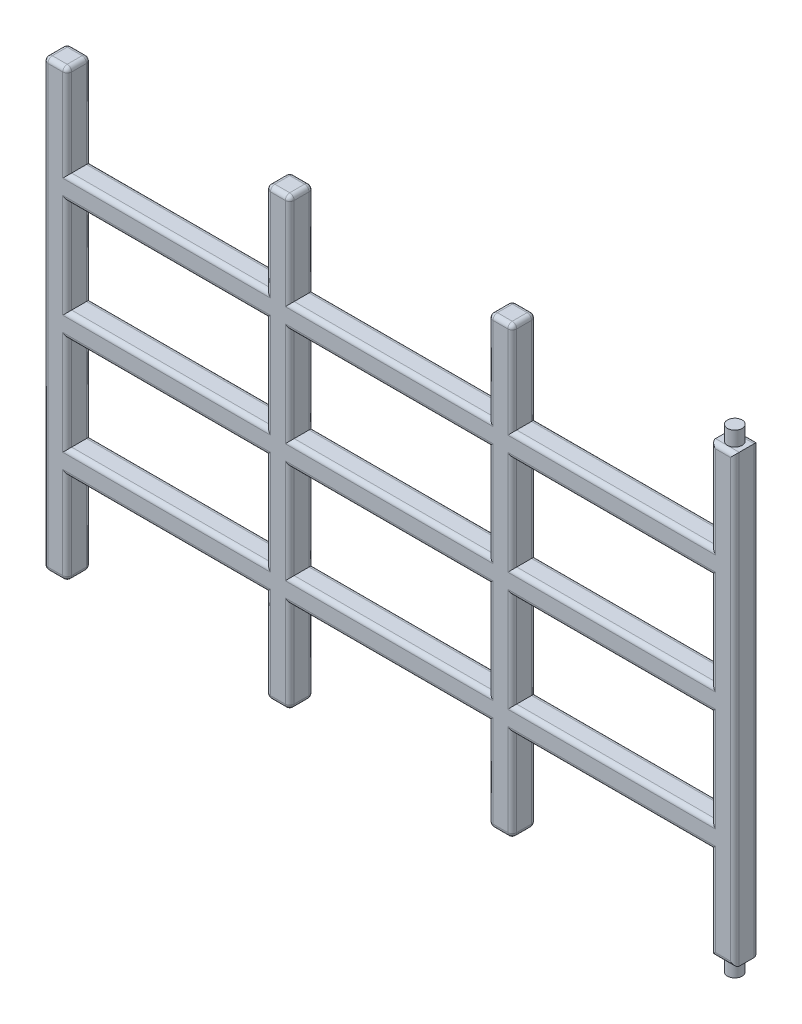
from build123d import *

# Parameters (mm, degrees)
SKETCH_1_W      = 8
SKETCH_1_H      = 31
SKETCH_1_W_2    = 67
SKETCH_1_H_2    = 8
SKETCH_1_H_3    = 32
EXTRUDE_1_DEPTH = 8
FILLET_3_R      = 1.5
SKETCH_2_R      = 2.475
EXTRUDE_5_DEPTH = 4.95
EXTRUDE_START   = 4.95
SKETCH_3_R      = 2.475
EXTRUDE_6_DEPTH = 4.95
FILLET_4_R      = 1.5


with BuildPart() as part:
    # 草图1 → 凸台-拉伸1 (new body)
    with BuildSketch(Plane.XY):
        with Locations((4, 134.5)):
            Rectangle(SKETCH_1_W, SKETCH_1_H)
        with Locations((41.5, 115)):
            Rectangle(SKETCH_1_W_2, SKETCH_1_H_2)
        with Locations((4, 115)):
            Rectangle(SKETCH_1_W, SKETCH_1_H_2)
        with Locations((4, 95)):
            Rectangle(SKETCH_1_W, SKETCH_1_H_3)
        with Locations((41.5, 75)):
            Rectangle(SKETCH_1_W_2, SKETCH_1_H_2)
        with Locations((4, 55)):
            Rectangle(SKETCH_1_W, SKETCH_1_H_3)
        with Locations((4, 75)):
            Rectangle(SKETCH_1_W, SKETCH_1_H_2)
        with Locations((4, 35)):
            Rectangle(SKETCH_1_W, SKETCH_1_H_2)
        with Locations((4, 15.5)):
            Rectangle(SKETCH_1_W, SKETCH_1_H)
        with Locations((41.5, 35)):
            Rectangle(SKETCH_1_W_2, SKETCH_1_H_2)
        with Locations((79, 35)):
            Rectangle(SKETCH_1_W, SKETCH_1_H_2)
        with Locations((79, 15.5)):
            Rectangle(SKETCH_1_W, SKETCH_1_H)
        with Locations((79, 55)):
            Rectangle(SKETCH_1_W, SKETCH_1_H_3)
        with Locations((79, 75)):
            Rectangle(SKETCH_1_W, SKETCH_1_H_2)
        with Locations((79, 95)):
            Rectangle(SKETCH_1_W, SKETCH_1_H_3)
        with Locations((79, 115)):
            Rectangle(SKETCH_1_W, SKETCH_1_H_2)
        with Locations((79, 134.5)):
            Rectangle(SKETCH_1_W, SKETCH_1_H)
        with Locations((116.5, 115)):
            Rectangle(SKETCH_1_W_2, SKETCH_1_H_2)
        with Locations((116.5, 75)):
            Rectangle(SKETCH_1_W_2, SKETCH_1_H_2)
        with Locations((116.5, 35)):
            Rectangle(SKETCH_1_W_2, SKETCH_1_H_2)
        with Locations((154, 15.5)):
            Rectangle(SKETCH_1_W, SKETCH_1_H)
        with Locations((154, 35)):
            Rectangle(SKETCH_1_W, SKETCH_1_H_2)
        with Locations((154, 55)):
            Rectangle(SKETCH_1_W, SKETCH_1_H_3)
        with Locations((154, 75)):
            Rectangle(SKETCH_1_W, SKETCH_1_H_2)
        with Locations((154, 95)):
            Rectangle(SKETCH_1_W, SKETCH_1_H_3)
        with Locations((154, 115)):
            Rectangle(SKETCH_1_W, SKETCH_1_H_2)
        with Locations((154, 134.5)):
            Rectangle(SKETCH_1_W, SKETCH_1_H)
        with Locations((191.5, 115)):
            Rectangle(SKETCH_1_W_2, SKETCH_1_H_2)
        with Locations((191.5, 75)):
            Rectangle(SKETCH_1_W_2, SKETCH_1_H_2)
        with Locations((191.5, 35)):
            Rectangle(SKETCH_1_W_2, SKETCH_1_H_2)
        with Locations((229, 15.5)):
            Rectangle(SKETCH_1_W, SKETCH_1_H)
        with Locations((229, 35)):
            Rectangle(SKETCH_1_W, SKETCH_1_H_2)
        with Locations((229, 55)):
            Rectangle(SKETCH_1_W, SKETCH_1_H_3)
        with Locations((229, 75)):
            Rectangle(SKETCH_1_W, SKETCH_1_H_2)
        with Locations((229, 95)):
            Rectangle(SKETCH_1_W, SKETCH_1_H_3)
        with Locations((229, 115)):
            Rectangle(SKETCH_1_W, SKETCH_1_H_2)
        with Locations((229, 134.5)):
            Rectangle(SKETCH_1_W, SKETCH_1_H)
    extrude(amount=EXTRUDE_1_DEPTH)

    # 圆角3
    fillet_3_edges = [part.edges().sort_by_distance(p)[0] for p in [
        (4, 150, 8),
        (0, 75, 8),
        (191.5, 31, 8),
        (4, 0, 8),
        (8, 15.5, 8),
        (41.5, 31, 8),
        (75, 15.5, 8),
        (79, 0, 8),
        (83, 15.5, 8),
        (116.5, 31, 8),
        (150, 15.5, 8),
        (154, 0, 8),
        (225, 15.5, 8),
        (158, 15.5, 8),
        (225, 55, 8),
        (191.5, 39, 8),
        (158, 55, 8),
        (191.5, 71, 8),
        (150, 55, 8),
        (116.5, 39, 8),
        (83, 55, 8),
        (116.5, 71, 8),
        (225, 95, 8),
        (229, 0, 8),
        (191.5, 79, 8),
        (158, 95, 8),
        (191.5, 111, 8),
        (75, 55, 8),
        (41.5, 39, 8),
        (8, 55, 8),
        (41.5, 71, 8),
        (150, 95, 8),
        (116.5, 79, 8),
        (83, 95, 8),
        (233, 75, 8),
        (116.5, 111, 8),
        (75, 95, 8),
        (41.5, 79, 8),
        (8, 95, 8),
        (41.5, 111, 8),
        (229, 150, 8),
        (225, 134.5, 8),
        (191.5, 119, 8),
        (158, 134.5, 8),
        (41.5, 111, 0),
        (8, 95, 0),
        (41.5, 79, 0),
        (75, 95, 0),
        (154, 150, 8),
        (116.5, 111, 0),
        (83, 95, 0),
        (116.5, 79, 0),
        (150, 95, 0),
        (41.5, 71, 0),
        (8, 55, 0),
        (41.5, 39, 0),
        (75, 55, 0),
        (191.5, 111, 0),
        (158, 95, 0),
        (150, 134.5, 8),
        (191.5, 79, 0),
        (225, 95, 0),
        (116.5, 71, 0),
        (83, 55, 0),
        (116.5, 39, 0),
        (150, 55, 0),
        (191.5, 71, 0),
        (158, 55, 0),
        (191.5, 39, 0),
        (225, 55, 0),
        (116.5, 119, 8),
        (158, 15.5, 0),
        (154, 0, 0),
        (150, 15.5, 0),
        (116.5, 31, 0),
        (83, 15.5, 0),
        (79, 0, 0),
        (75, 15.5, 0),
        (41.5, 31, 0),
        (8, 15.5, 0),
        (4, 0, 0),
        (83, 134.5, 8),
        (0, 75, 0),
        (4, 150, 0),
        (8, 134.5, 0),
        (41.5, 119, 0),
        (75, 134.5, 0),
        (79, 150, 0),
        (83, 134.5, 0),
        (116.5, 119, 0),
        (79, 150, 8),
        (150, 134.5, 0),
        (154, 150, 0),
        (158, 134.5, 0),
        (191.5, 119, 0),
        (225, 134.5, 0),
        (229, 150, 0),
        (233, 75, 0),
        (229, 0, 0),
        (75, 134.5, 8),
        (225, 15.5, 0),
        (191.5, 31, 0),
        (41.5, 119, 8),
        (8, 134.5, 8),
    ]]
    fillet(fillet_3_edges, radius=FILLET_3_R)

    # 草图2 → 凸台-拉伸5 (add)
    with BuildSketch(Plane(origin=(0, 150, 0), x_dir=(1, 0, 0), z_dir=(0, 1, 0))):
        with Locations((229, -4)):
            Circle(SKETCH_2_R)
    extrude(amount=EXTRUDE_5_DEPTH)

    # 草图3 → 凸台-拉伸6 (add)
    with BuildSketch(Plane.XZ.offset(EXTRUDE_START)):
        with Locations((229, 4)):
            Circle(SKETCH_3_R)
    extrude(amount=-EXTRUDE_6_DEPTH)

    # 圆角4
    # the kernel refuses this fillet: 1.5 mm, written as the material it takes off along each edge
    with BuildSketch(Plane(origin=(76.5, 148.5, 6.5), x_dir=(-1, 0, 0), z_dir=(0, 1, 0))) as fillet_4_piece_1_section:
        Polygon((0, 0), (FILLET_4_R, 0), (FILLET_4_R, FILLET_4_R), (0, FILLET_4_R), align=None)
    fillet_4_piece_1 = extrude(amount=FILLET_4_R, mode=Mode.PRIVATE)
    fillet_4_piece_1 = fillet_4_piece_1 - Plane(origin=(76.5, 148.5, 6.5), x_dir=(0.7071067811865475, 0, -0.7071067811865475), z_dir=(0, 1, 0)) * Sphere(FILLET_4_R, mode=Mode.PRIVATE)
    add(fillet_4_piece_1, mode=Mode.SUBTRACT)
    with BuildSketch(Plane(origin=(81.5, 148.5, 6.5), x_dir=(0, 1, 0), z_dir=(1, 0, 0))) as fillet_4_piece_2_section:
        Polygon((0, 0), (FILLET_4_R, 0), (FILLET_4_R, FILLET_4_R), (0, FILLET_4_R), align=None)
    fillet_4_piece_2 = extrude(amount=FILLET_4_R, mode=Mode.PRIVATE)
    fillet_4_piece_2 = fillet_4_piece_2 - Plane(origin=(81.5, 148.5, 6.5), x_dir=(0, -0.7071067811865475, -0.7071067811865475), z_dir=(1, 0, 0)) * Sphere(FILLET_4_R, mode=Mode.PRIVATE)
    add(fillet_4_piece_2, mode=Mode.SUBTRACT)
    with BuildSketch(Plane(origin=(6.5, 148.5, 6.5), x_dir=(1, 0, 0), z_dir=(0, 1, 0))) as fillet_4_piece_3_section:
        Polygon((0, 0), (FILLET_4_R, 0), (FILLET_4_R, -FILLET_4_R), (0, -FILLET_4_R), align=None)
    fillet_4_piece_3 = extrude(amount=FILLET_4_R, mode=Mode.PRIVATE)
    fillet_4_piece_3 = fillet_4_piece_3 - Plane(origin=(6.5, 148.5, 6.5), x_dir=(-0.7071067811865475, -3.74796264330965e-15, -0.7071067811865475), z_dir=(0, 1, 0)) * Sphere(FILLET_4_R, mode=Mode.PRIVATE)
    add(fillet_4_piece_3, mode=Mode.SUBTRACT)
    with BuildSketch(Plane(origin=(1.5, 148.5, 6.5), x_dir=(0, 1, 0), z_dir=(-1, 0, 0))) as fillet_4_piece_4_section:
        Polygon((0, 0), (FILLET_4_R, 0), (FILLET_4_R, -FILLET_4_R), (0, -FILLET_4_R), align=None)
    fillet_4_piece_4 = extrude(amount=FILLET_4_R, mode=Mode.PRIVATE)
    fillet_4_piece_4 = fillet_4_piece_4 - Plane(origin=(1.5, 148.5, 6.5), x_dir=(-2.5121479338942844e-15, -0.7071067811865475, -0.7071067811865475), z_dir=(-1, 0, 0)) * Sphere(FILLET_4_R, mode=Mode.PRIVATE)
    add(fillet_4_piece_4, mode=Mode.SUBTRACT)
    with BuildSketch(Plane(origin=(151.5, 148.5, 6.5), x_dir=(-1, 0, 0), z_dir=(0, 1, 0))) as fillet_4_piece_5_section:
        Polygon((0, 0), (FILLET_4_R, 0), (FILLET_4_R, FILLET_4_R), (0, FILLET_4_R), align=None)
    fillet_4_piece_5 = extrude(amount=FILLET_4_R, mode=Mode.PRIVATE)
    fillet_4_piece_5 = fillet_4_piece_5 - Plane(origin=(151.5, 148.5, 6.5), x_dir=(0.7071067811865475, 0, -0.7071067811865475), z_dir=(0, 1, 0)) * Sphere(FILLET_4_R, mode=Mode.PRIVATE)
    add(fillet_4_piece_5, mode=Mode.SUBTRACT)
    with BuildSketch(Plane(origin=(1.5, 1.5, 6.5), x_dir=(-1, 0, 0), z_dir=(0, -1, 0))) as fillet_4_piece_6_section:
        Polygon((0, 0), (FILLET_4_R, 0), (FILLET_4_R, -FILLET_4_R), (0, -FILLET_4_R), align=None)
    fillet_4_piece_6 = extrude(amount=FILLET_4_R, mode=Mode.PRIVATE)
    fillet_4_piece_6 = fillet_4_piece_6 - Plane(origin=(1.5, 1.5, 6.5), x_dir=(0.7071067811865475, 0, -0.7071067811865475), z_dir=(0, -1, 0)) * Sphere(FILLET_4_R, mode=Mode.PRIVATE)
    add(fillet_4_piece_6, mode=Mode.SUBTRACT)
    with BuildSketch(Plane(origin=(156.5, 148.5, 6.5), x_dir=(0, 1, 0), z_dir=(1, 0, 0))) as fillet_4_piece_7_section:
        Polygon((0, 0), (FILLET_4_R, 0), (FILLET_4_R, FILLET_4_R), (0, FILLET_4_R), align=None)
    fillet_4_piece_7 = extrude(amount=FILLET_4_R, mode=Mode.PRIVATE)
    fillet_4_piece_7 = fillet_4_piece_7 - Plane(origin=(156.5, 148.5, 6.5), x_dir=(0, -0.7071067811865475, -0.7071067811865475), z_dir=(1, 0, 0)) * Sphere(FILLET_4_R, mode=Mode.PRIVATE)
    add(fillet_4_piece_7, mode=Mode.SUBTRACT)
    with BuildSketch(Plane(origin=(6.5, 1.5, 6.5), x_dir=(0, -1, 0), z_dir=(1, 0, 0))) as fillet_4_piece_8_section:
        Polygon((0, 0), (FILLET_4_R, 0), (FILLET_4_R, -FILLET_4_R), (0, -FILLET_4_R), align=None)
    fillet_4_piece_8 = extrude(amount=FILLET_4_R, mode=Mode.PRIVATE)
    fillet_4_piece_8 = fillet_4_piece_8 - Plane(origin=(6.5, 1.5, 6.5), x_dir=(0, 0.7071067811865475, -0.7071067811865475), z_dir=(1, 0, 0)) * Sphere(FILLET_4_R, mode=Mode.PRIVATE)
    add(fillet_4_piece_8, mode=Mode.SUBTRACT)
    with BuildSketch(Plane(origin=(76.5, 1.5, 6.5), x_dir=(-1, 0, 0), z_dir=(0, -1, 0))) as fillet_4_piece_9_section:
        Polygon((0, 0), (FILLET_4_R, 0), (FILLET_4_R, -FILLET_4_R), (0, -FILLET_4_R), align=None)
    fillet_4_piece_9 = extrude(amount=FILLET_4_R, mode=Mode.PRIVATE)
    fillet_4_piece_9 = fillet_4_piece_9 - Plane(origin=(76.5, 1.5, 6.5), x_dir=(0.7071067811865475, 0, -0.7071067811865475), z_dir=(0, -1, 0)) * Sphere(FILLET_4_R, mode=Mode.PRIVATE)
    add(fillet_4_piece_9, mode=Mode.SUBTRACT)
    with BuildSketch(Plane(origin=(81.5, 1.5, 6.5), x_dir=(0, -1, 0), z_dir=(1, 0, 0))) as fillet_4_piece_10_section:
        Polygon((0, 0), (FILLET_4_R, 0), (FILLET_4_R, -FILLET_4_R), (0, -FILLET_4_R), align=None)
    fillet_4_piece_10 = extrude(amount=FILLET_4_R, mode=Mode.PRIVATE)
    fillet_4_piece_10 = fillet_4_piece_10 - Plane(origin=(81.5, 1.5, 6.5), x_dir=(0, 0.7071067811865475, -0.7071067811865475), z_dir=(1, 0, 0)) * Sphere(FILLET_4_R, mode=Mode.PRIVATE)
    add(fillet_4_piece_10, mode=Mode.SUBTRACT)
    with BuildSketch(Plane(origin=(151.5, 1.5, 6.5), x_dir=(-1, 0, 0), z_dir=(0, -1, 0))) as fillet_4_piece_11_section:
        Polygon((0, 0), (FILLET_4_R, 0), (FILLET_4_R, -FILLET_4_R), (0, -FILLET_4_R), align=None)
    fillet_4_piece_11 = extrude(amount=FILLET_4_R, mode=Mode.PRIVATE)
    fillet_4_piece_11 = fillet_4_piece_11 - Plane(origin=(151.5, 1.5, 6.5), x_dir=(0.7071067811865475, 0, -0.7071067811865475), z_dir=(0, -1, 0)) * Sphere(FILLET_4_R, mode=Mode.PRIVATE)
    add(fillet_4_piece_11, mode=Mode.SUBTRACT)
    with BuildSketch(Plane(origin=(156.5, 1.5, 6.5), x_dir=(0, -1, 0), z_dir=(1, 0, 0))) as fillet_4_piece_12_section:
        Polygon((0, 0), (FILLET_4_R, 0), (FILLET_4_R, -FILLET_4_R), (0, -FILLET_4_R), align=None)
    fillet_4_piece_12 = extrude(amount=FILLET_4_R, mode=Mode.PRIVATE)
    fillet_4_piece_12 = fillet_4_piece_12 - Plane(origin=(156.5, 1.5, 6.5), x_dir=(0, 0.7071067811865475, -0.7071067811865475), z_dir=(1, 0, 0)) * Sphere(FILLET_4_R, mode=Mode.PRIVATE)
    add(fillet_4_piece_12, mode=Mode.SUBTRACT)
    with BuildSketch(Plane(origin=(6.5, 148.5, 1.5), x_dir=(1, 0, 0), z_dir=(0, 1, 0))) as fillet_4_piece_13_section:
        Polygon((0, 0), (FILLET_4_R, 0), (FILLET_4_R, FILLET_4_R), (0, FILLET_4_R), align=None)
    fillet_4_piece_13 = extrude(amount=FILLET_4_R, mode=Mode.PRIVATE)
    fillet_4_piece_13 = fillet_4_piece_13 - Plane(origin=(6.5, 148.5, 1.5), x_dir=(-0.7071067811865475, -3.74796264330965e-15, 0.7071067811865475), z_dir=(0, 1, 0)) * Sphere(FILLET_4_R, mode=Mode.PRIVATE)
    add(fillet_4_piece_13, mode=Mode.SUBTRACT)
    with BuildSketch(Plane(origin=(1.5, 148.5, 1.5), x_dir=(0, 1, 0), z_dir=(-1, 0, 0))) as fillet_4_piece_14_section:
        Polygon((0, 0), (FILLET_4_R, 0), (FILLET_4_R, FILLET_4_R), (0, FILLET_4_R), align=None)
    fillet_4_piece_14 = extrude(amount=FILLET_4_R, mode=Mode.PRIVATE)
    fillet_4_piece_14 = fillet_4_piece_14 - Plane(origin=(1.5, 148.5, 1.5), x_dir=(-2.5121479338942844e-15, -0.7071067811865475, 0.7071067811865475), z_dir=(-1, 0, 0)) * Sphere(FILLET_4_R, mode=Mode.PRIVATE)
    add(fillet_4_piece_14, mode=Mode.SUBTRACT)
    with BuildSketch(Plane(origin=(1.5, 1.5, 1.5), x_dir=(-1, 0, 0), z_dir=(0, -1, 0))) as fillet_4_piece_15_section:
        Polygon((0, 0), (FILLET_4_R, 0), (FILLET_4_R, FILLET_4_R), (0, FILLET_4_R), align=None)
    fillet_4_piece_15 = extrude(amount=FILLET_4_R, mode=Mode.PRIVATE)
    fillet_4_piece_15 = fillet_4_piece_15 - Plane(origin=(1.5, 1.5, 1.5), x_dir=(0.7071067811865475, 0, 0.7071067811865475), z_dir=(0, -1, 0)) * Sphere(FILLET_4_R, mode=Mode.PRIVATE)
    add(fillet_4_piece_15, mode=Mode.SUBTRACT)
    with BuildSketch(Plane(origin=(76.5, 148.5, 1.5), x_dir=(-1, 0, 0), z_dir=(0, 1, 0))) as fillet_4_piece_16_section:
        Polygon((0, 0), (FILLET_4_R, 0), (FILLET_4_R, -FILLET_4_R), (0, -FILLET_4_R), align=None)
    fillet_4_piece_16 = extrude(amount=FILLET_4_R, mode=Mode.PRIVATE)
    fillet_4_piece_16 = fillet_4_piece_16 - Plane(origin=(76.5, 148.5, 1.5), x_dir=(0.7071067811865475, 0, 0.7071067811865475), z_dir=(0, 1, 0)) * Sphere(FILLET_4_R, mode=Mode.PRIVATE)
    add(fillet_4_piece_16, mode=Mode.SUBTRACT)
    with BuildSketch(Plane(origin=(6.5, 1.5, 1.5), x_dir=(0, -1, 0), z_dir=(1, 0, 0))) as fillet_4_piece_17_section:
        Polygon((0, 0), (FILLET_4_R, 0), (FILLET_4_R, FILLET_4_R), (0, FILLET_4_R), align=None)
    fillet_4_piece_17 = extrude(amount=FILLET_4_R, mode=Mode.PRIVATE)
    fillet_4_piece_17 = fillet_4_piece_17 - Plane(origin=(6.5, 1.5, 1.5), x_dir=(0, 0.7071067811865475, 0.7071067811865475), z_dir=(1, 0, 0)) * Sphere(FILLET_4_R, mode=Mode.PRIVATE)
    add(fillet_4_piece_17, mode=Mode.SUBTRACT)
    with BuildSketch(Plane(origin=(81.5, 148.5, 1.5), x_dir=(0, 1, 0), z_dir=(1, 0, 0))) as fillet_4_piece_18_section:
        Polygon((0, 0), (FILLET_4_R, 0), (FILLET_4_R, -FILLET_4_R), (0, -FILLET_4_R), align=None)
    fillet_4_piece_18 = extrude(amount=FILLET_4_R, mode=Mode.PRIVATE)
    fillet_4_piece_18 = fillet_4_piece_18 - Plane(origin=(81.5, 148.5, 1.5), x_dir=(0, -0.7071067811865475, 0.7071067811865475), z_dir=(1, 0, 0)) * Sphere(FILLET_4_R, mode=Mode.PRIVATE)
    add(fillet_4_piece_18, mode=Mode.SUBTRACT)
    with BuildSketch(Plane(origin=(76.5, 1.5, 1.5), x_dir=(-1, 0, 0), z_dir=(0, -1, 0))) as fillet_4_piece_19_section:
        Polygon((0, 0), (FILLET_4_R, 0), (FILLET_4_R, FILLET_4_R), (0, FILLET_4_R), align=None)
    fillet_4_piece_19 = extrude(amount=FILLET_4_R, mode=Mode.PRIVATE)
    fillet_4_piece_19 = fillet_4_piece_19 - Plane(origin=(76.5, 1.5, 1.5), x_dir=(0.7071067811865475, 0, 0.7071067811865475), z_dir=(0, -1, 0)) * Sphere(FILLET_4_R, mode=Mode.PRIVATE)
    add(fillet_4_piece_19, mode=Mode.SUBTRACT)
    with BuildSketch(Plane(origin=(151.5, 148.5, 1.5), x_dir=(-1, 0, 0), z_dir=(0, 1, 0))) as fillet_4_piece_20_section:
        Polygon((0, 0), (FILLET_4_R, 0), (FILLET_4_R, -FILLET_4_R), (0, -FILLET_4_R), align=None)
    fillet_4_piece_20 = extrude(amount=FILLET_4_R, mode=Mode.PRIVATE)
    fillet_4_piece_20 = fillet_4_piece_20 - Plane(origin=(151.5, 148.5, 1.5), x_dir=(0.7071067811865475, 0, 0.7071067811865475), z_dir=(0, 1, 0)) * Sphere(FILLET_4_R, mode=Mode.PRIVATE)
    add(fillet_4_piece_20, mode=Mode.SUBTRACT)
    with BuildSketch(Plane(origin=(81.5, 1.5, 1.5), x_dir=(0, -1, 0), z_dir=(1, 0, 0))) as fillet_4_piece_21_section:
        Polygon((0, 0), (FILLET_4_R, 0), (FILLET_4_R, FILLET_4_R), (0, FILLET_4_R), align=None)
    fillet_4_piece_21 = extrude(amount=FILLET_4_R, mode=Mode.PRIVATE)
    fillet_4_piece_21 = fillet_4_piece_21 - Plane(origin=(81.5, 1.5, 1.5), x_dir=(0, 0.7071067811865475, 0.7071067811865475), z_dir=(1, 0, 0)) * Sphere(FILLET_4_R, mode=Mode.PRIVATE)
    add(fillet_4_piece_21, mode=Mode.SUBTRACT)
    with BuildSketch(Plane(origin=(156.5, 148.5, 1.5), x_dir=(0, 1, 0), z_dir=(1, 0, 0))) as fillet_4_piece_22_section:
        Polygon((0, 0), (FILLET_4_R, 0), (FILLET_4_R, -FILLET_4_R), (0, -FILLET_4_R), align=None)
    fillet_4_piece_22 = extrude(amount=FILLET_4_R, mode=Mode.PRIVATE)
    fillet_4_piece_22 = fillet_4_piece_22 - Plane(origin=(156.5, 148.5, 1.5), x_dir=(0, -0.7071067811865475, 0.7071067811865475), z_dir=(1, 0, 0)) * Sphere(FILLET_4_R, mode=Mode.PRIVATE)
    add(fillet_4_piece_22, mode=Mode.SUBTRACT)
    with BuildSketch(Plane(origin=(151.5, 1.5, 1.5), x_dir=(-1, 0, 0), z_dir=(0, -1, 0))) as fillet_4_piece_23_section:
        Polygon((0, 0), (FILLET_4_R, 0), (FILLET_4_R, FILLET_4_R), (0, FILLET_4_R), align=None)
    fillet_4_piece_23 = extrude(amount=FILLET_4_R, mode=Mode.PRIVATE)
    fillet_4_piece_23 = fillet_4_piece_23 - Plane(origin=(151.5, 1.5, 1.5), x_dir=(0.7071067811865475, 0, 0.7071067811865475), z_dir=(0, -1, 0)) * Sphere(FILLET_4_R, mode=Mode.PRIVATE)
    add(fillet_4_piece_23, mode=Mode.SUBTRACT)
    with BuildSketch(Plane(origin=(156.5, 1.5, 1.5), x_dir=(0, -1, 0), z_dir=(1, 0, 0))) as fillet_4_piece_24_section:
        Polygon((0, 0), (FILLET_4_R, 0), (FILLET_4_R, FILLET_4_R), (0, FILLET_4_R), align=None)
    fillet_4_piece_24 = extrude(amount=FILLET_4_R, mode=Mode.PRIVATE)
    fillet_4_piece_24 = fillet_4_piece_24 - Plane(origin=(156.5, 1.5, 1.5), x_dir=(0, 0.7071067811865475, 0.7071067811865475), z_dir=(1, 0, 0)) * Sphere(FILLET_4_R, mode=Mode.PRIVATE)
    add(fillet_4_piece_24, mode=Mode.SUBTRACT)
    with BuildSketch(Plane(origin=(158, 0, 1.5), x_dir=(0, 1, 0), z_dir=(0, 0, 1)), Plane(origin=(150, 0, 1.5), x_dir=(1, 0, 0), z_dir=(0, 0, 1)), Plane(origin=(83, 0, 1.5), x_dir=(0, 1, 0), z_dir=(0, 0, 1)), Plane(origin=(75, 0, 1.5), x_dir=(1, 0, 0), z_dir=(0, 0, 1)), Plane(origin=(8, 0, 1.5), x_dir=(0, 1, 0), z_dir=(0, 0, 1)), Plane(origin=(0, 0, 1.5), x_dir=(1, 0, 0), z_dir=(0, 0, 1)), Plane(origin=(0, 150, 1.5), x_dir=(0, -1, 0), z_dir=(0, 0, 1)), Plane(origin=(8, 150, 1.5), x_dir=(-1, 0, 0), z_dir=(0, 0, 1))) as fillet_4_piece_25:
        with BuildLine():
            CenterArc((FILLET_4_R, FILLET_4_R), FILLET_4_R, 180, 90)
            Line((0, FILLET_4_R), (0, 0))
            Line((0, 0), (FILLET_4_R, 0))
        make_face()
    extrude(amount=5, mode=Mode.SUBTRACT)
    with BuildSketch(Plane(origin=(75, 150, 1.5), x_dir=(1, 0, 0), z_dir=(0, 0, 1)), Plane(origin=(83, 150, 1.5), x_dir=(0, -1, 0), z_dir=(0, 0, 1)), Plane(origin=(150, 150, 1.5), x_dir=(1, 0, 0), z_dir=(0, 0, 1)), Plane(origin=(158, 150, 1.5), x_dir=(0, -1, 0), z_dir=(0, 0, 1))) as fillet_4_piece_26:
        with BuildLine():
            CenterArc((FILLET_4_R, -FILLET_4_R), FILLET_4_R, 90, 90)
            Line((0, -FILLET_4_R), (0, 0))
            Line((0, 0), (FILLET_4_R, 0))
        make_face()
    extrude(amount=5, mode=Mode.SUBTRACT)


solid = part.part
